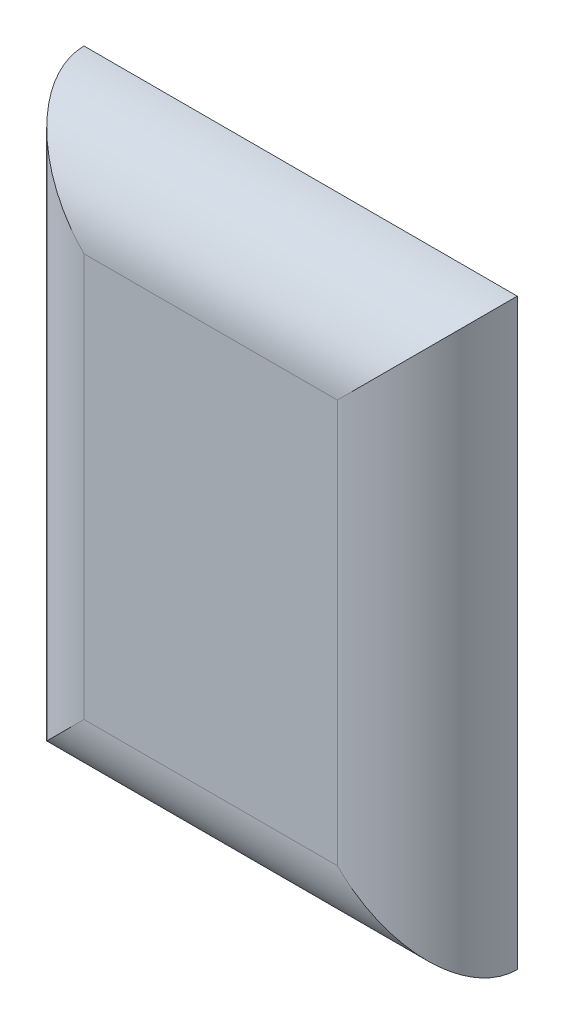
from build123d import *

# Parameters (mm, degrees)
SKETCH1_W           = 260
SKETCH1_H           = 350
BOSS_EXTRUDE1_DEPTH = 54
FILLET1_R           = 54


with BuildPart() as part:
    # Sketch1 → Boss-Extrude1 (new body)
    with BuildSketch(Plane.XY):
        Rectangle(SKETCH1_W, SKETCH1_H)
    extrude(amount=BOSS_EXTRUDE1_DEPTH)

    # Fillet1
    fillet1_edges = [part.edges().sort_by_distance(p)[0] for p in [
        (130, 0, 54),
        (-130, 0, 54),
        (0, -175, 54),
        (0, 175, 54),
    ]]
    fillet(fillet1_edges, radius=FILLET1_R - 0.0001)  # a hair under: the kernel refuses the full size


solid = part.part
